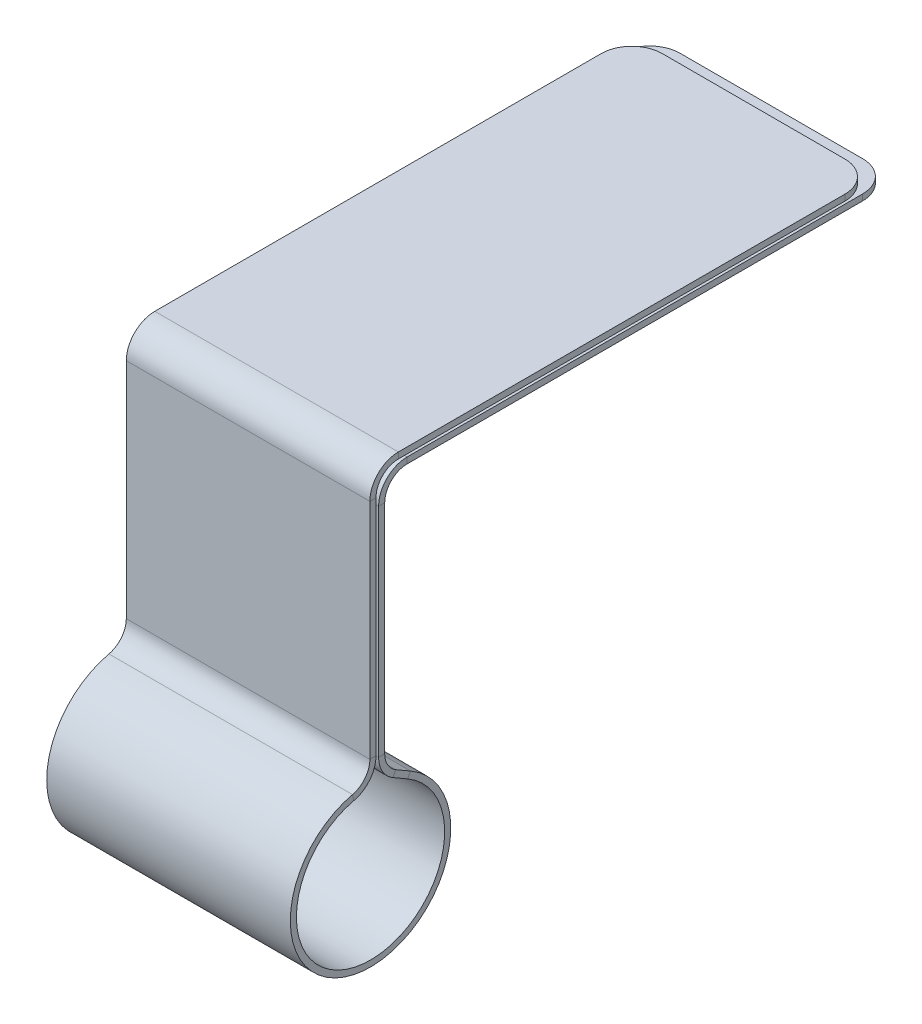
from build123d import *

# Parameters (mm, degrees)
SKETCH1_W                    = 8
SKETCH1_H                    = 16.7
BASE_FLANGE1_DEPTH           = 0.2
EDGE_FLANGE2_STRIP_W         = 2.2732
EDGE_FLANGE2_STRIP_H         = 0.2
EDGE_FLANGE2_STRIP_CUT_DEPTH = 8
EDGE_FLANGE2_DEPTH           = 8
EDGE_FLANGE3_STRIP_CUT_DEPTH = 8
EDGE_FLANGE3_DEPTH           = 8
HEM1_START                   = -4
HEM1_DEPTH                   = 8
EDGE_FLANGE4_START           = -4
EDGE_FLANGE4_DEPTH           = 8
EDGE_FLANGE5_STRIP_W         = 2.2732
EDGE_FLANGE5_STRIP_H         = 0.2
EDGE_FLANGE5_STRIP_CUT_DEPTH = 8
EDGE_FLANGE5_DEPTH           = 8
FILLET1_R                    = 1


# Read off the part's stored shape, not the designer's step: Hem1, Edge-Flange4
# Sheet-metal steps are written as plain solids
with BuildPart() as part:
    # Sketch1 → Base-Flange1 (new body)
    with BuildSketch(Plane(origin=(0, 0, 0), x_dir=(1, 0, 0), z_dir=(0, 1, 0))):
        with Locations((0, 8.35)):
            Rectangle(SKETCH1_W, SKETCH1_H)
    extrude(amount=BASE_FLANGE1_DEPTH)

    # Edge-Flange2 strip (across the edge) → Edge-Flange2 strip cut (cut)
    with BuildSketch(Plane(origin=(4, 0, 0), x_dir=(0, 0, -1), z_dir=(-1, 0, 0))):
        with Locations((-0.4, -0.1)):
            Rectangle(EDGE_FLANGE2_STRIP_W, EDGE_FLANGE2_STRIP_H)
    extrude(amount=EDGE_FLANGE2_STRIP_CUT_DEPTH, mode=Mode.SUBTRACT)

    # Edge-Flange2 section (across the edge) → Edge-Flange2 (add)
    with BuildSketch(Plane(origin=(4, 0, 0), x_dir=(0, 0, -1), z_dir=(-1, 0, 0))):
        with BuildLine():
            Line((-0.2, 0.7366), (-0.2, 8.3))
            Line((-0.2, 8.3), (0, 8.3))
            Line((0, 8.3), (0, 0.7366))
            ThreePointArc((0, 0.7366), (0.215745145, 0.215745145), (0.7366, 0))
            Line((0.7366, 0), (0.7366, -0.2))
            ThreePointArc((0.7366, -0.2), (0.074323789, 0.074323789), (-0.2, 0.7366))
        make_face()
    extrude(amount=EDGE_FLANGE2_DEPTH)

    # Edge-Flange3 strip (across the edge) → Edge-Flange3 strip cut (cut)
    with BuildSketch(Plane(origin=(4, -8.3, 0), x_dir=(0, 0.8660254037844346, -0.5000000000000071), z_dir=(-1, 0, 0))):
        Polygon((-1.700348948, 0.750756815), (0.2683, -0.385843185), (0.3683, -0.212638104), (-1.600348948, 0.923961896), align=None)
    extrude(amount=EDGE_FLANGE3_STRIP_CUT_DEPTH, mode=Mode.SUBTRACT)

    # Edge-Flange3 section (across the edge) → Edge-Flange3 (add)
    with BuildSketch(Plane(origin=(4, -8.3, 0), x_dir=(0, 0.8660254037844346, -0.5000000000000071), z_dir=(-1, 0, 0))):
        with BuildLine():
            Line((-0.2, 0.425276208), (-0.2, 0.984529946))
            Line((-0.2, 0.984529946), (0, 0.984529946))
            Line((0, 0.984529946), (0, 0.425276208))
            ThreePointArc((0, 0.425276208), (0.098685688, 0.056976208), (0.3683, -0.212638104))
            Line((0.3683, -0.212638104), (0.2683, -0.385843185))
            ThreePointArc((0.2683, -0.385843185), (-0.074519393, -0.043023792), (-0.2, 0.425276208))
        make_face()
    extrude(amount=EDGE_FLANGE3_DEPTH)

    # Hem1 outline → Hem1 (add)
    with BuildSketch(Plane.YZ.offset(HEM1_START)):
        with BuildLine():
            Line((-8.701650804, 1.012627873), (-8.506776791, 1.057618084))
            ThreePointArc((-8.506776791, 1.057618084), (-13.680298712, 0.854349855), (-8.792264973, -0.852627944))
            Line((-8.792264973, -0.852627944), (-8.965470054, -0.752627944))
            ThreePointArc((-8.965470054, -0.752627944), (-13.482495539, 0.824787973), (-8.701650804, 1.012627873))
        make_face()
    extrude(amount=HEM1_DEPTH)

    # Edge-Flange4 outline → Edge-Flange4 (add)
    with BuildSketch(Plane.YZ.offset(EDGE_FLANGE4_START)):
        with BuildLine():
            ThreePointArc((-8.701650804, 1.012627873), (-8.37210301, 0.490326231), (-7.789055802, 0.286717031))
            Line((-7.789055802, 0.286717031), (0.285026102, 0.286717031))
            Line((0.285026102, 0.286717031), (0.285026102, 0.486717031))
            Line((0.285026102, 0.486717031), (-7.789055802, 0.486717031))
            ThreePointArc((-7.789055802, 0.486717031), (-8.247600083, 0.646847862), (-8.506776791, 1.057618084))
            Line((-8.506776791, 1.057618084), (-8.701650804, 1.012627873))
        make_face()
    extrude(amount=EDGE_FLANGE4_DEPTH)

    # Edge-Flange5 strip (across the edge) → Edge-Flange5 strip cut (cut)
    with BuildSketch(Plane(origin=(-4, 0.285026102, 0.286717031), x_dir=(0, -1, 0), z_dir=(1, 0, 0))):
        with Locations((-0.4, -0.1)):
            Rectangle(EDGE_FLANGE5_STRIP_W, EDGE_FLANGE5_STRIP_H)
    extrude(amount=EDGE_FLANGE5_STRIP_CUT_DEPTH, mode=Mode.SUBTRACT)

    # Edge-Flange5 section (across the edge) → Edge-Flange5 (add)
    with BuildSketch(Plane(origin=(-4, 0.285026102, 0.286717031), x_dir=(0, -1, 0), z_dir=(1, 0, 0))):
        with BuildLine():
            Line((-0.2, 0.7366), (-0.2, 16.4))
            Line((-0.2, 16.4), (0, 16.4))
            Line((0, 16.4), (0, 0.7366))
            ThreePointArc((0, 0.7366), (0.215745145, 0.215745145), (0.7366, 0))
            Line((0.7366, 0), (0.7366, -0.2))
            ThreePointArc((0.7366, -0.2), (0.074323789, 0.074323789), (-0.2, 0.7366))
        make_face()
    extrude(amount=EDGE_FLANGE5_DEPTH)

    # Fillet1
    fillet1_edges = [part.edges().sort_by_distance(p)[0] for p in [
        (-4, 0.385026102, -16.113282969),
        (4, 0.385026102, -16.113282969),
        (-4, 0.1, -16.7),
        (4, 0.1, -16.7),
    ]]
    fillet(fillet1_edges, radius=FILLET1_R)


solid = part.part
